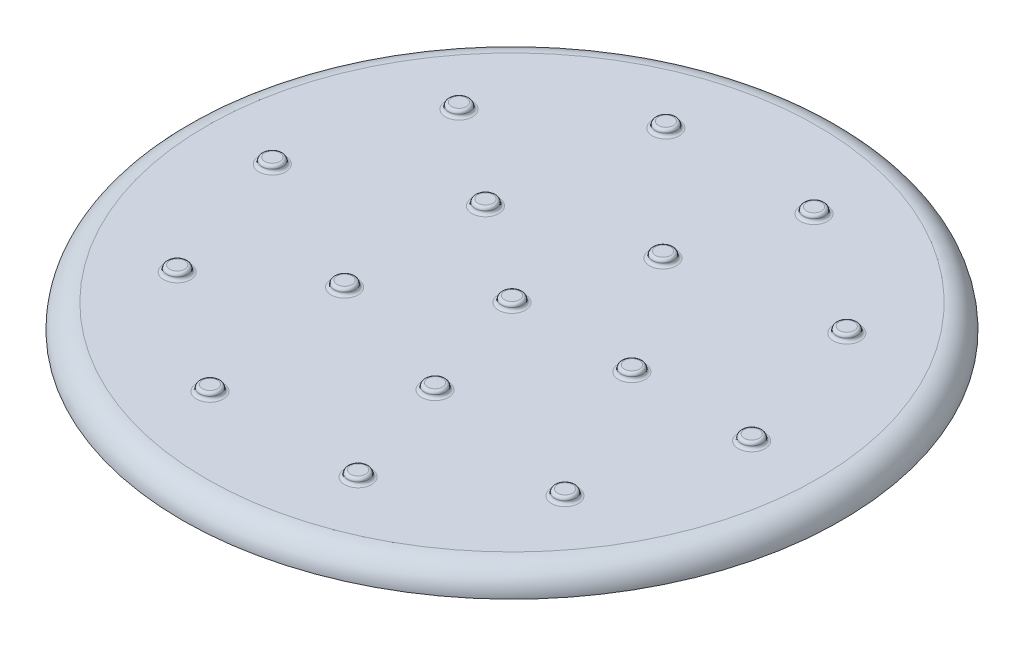
from build123d import *

# Parameters (mm, degrees)
SKETCH1_R           = 55
BOSS_EXTRUDE1_DEPTH = 4
FILLET4_R           = 4
SKETCH5_R           = 1.75
BOSS_EXTRUDE3_DEPTH = 1
FILLET6_R           = 0.5


with BuildPart() as part:
    # Sketch1 → Boss-Extrude1 (new body)
    with BuildSketch(Plane(origin=(0, 0, 0), x_dir=(1, 0, 0), z_dir=(0, 1, 0))):
        with Locations(Location((0, 0, 0), (0, 0, 270))):
            Circle(SKETCH1_R)
    extrude(amount=BOSS_EXTRUDE1_DEPTH)

    # Fillet4
    fillet4_edges = [part.edges().sort_by_distance(p)[0] for p in [
        (0, 4, -55),
    ]]
    fillet(fillet4_edges, radius=FILLET4_R - 0.0001)  # a hair under: the kernel refuses the full size

    # Sketch5 → Boss-Extrude3 (add)
    with BuildSketch(Plane(origin=(0, 4, 0), x_dir=(1, 0, 0), z_dir=(0, 1, 0))):
        with Locations(Location((0, 0, 0), (0, 0, 270))):
            Circle(SKETCH5_R)
        with Locations(Location((20, 0, 0), (0, 0, 270))):
            Circle(SKETCH5_R)
        with Locations(Location((40, 0, 0), (0, 0, 270))):
            Circle(SKETCH5_R)
        with Locations(Location((6.180339887, -19.021130326, 0), (0, 0, 270))):
            Circle(SKETCH5_R)
        with Locations(Location((-16.180339887, -11.755705046, 0), (0, 0, 270))):
            Circle(SKETCH5_R)
        with Locations(Location((-16.180339887, 11.755705046, 0), (0, 0, 270))):
            Circle(SKETCH5_R)
        with Locations(Location((6.180339887, 19.021130326, 0), (0, 0, 270))):
            Circle(SKETCH5_R)
        with Locations(Location((32.360679775, -23.511410092, 0), (0, 0, 270))):
            Circle(SKETCH5_R)
        with Locations(Location((12.360679775, -38.042260652, 0), (0, 0, 270))):
            Circle(SKETCH5_R)
        with Locations(Location((-12.360679775, -38.042260652, 0), (0, 0, 270))):
            Circle(SKETCH5_R)
        with Locations(Location((-32.360679775, -23.511410092, 0), (0, 0, 270))):
            Circle(SKETCH5_R)
        with Locations(Location((-40, 0, 0), (0, 0, 270))):
            Circle(SKETCH5_R)
        with Locations(Location((-32.360679775, 23.511410092, 0), (0, 0, 270))):
            Circle(SKETCH5_R)
        with Locations(Location((-12.360679775, 38.042260652, 0), (0, 0, 270))):
            Circle(SKETCH5_R)
        with Locations(Location((12.360679775, 38.042260652, 0), (0, 0, 270))):
            Circle(SKETCH5_R)
        with Locations(Location((32.360679775, 23.511410092, 0), (0, 0, 270))):
            Circle(SKETCH5_R)
    extrude(amount=BOSS_EXTRUDE3_DEPTH)

    # Fillet6
    fillet6_edges = [part.edges().sort_by_distance(p)[0] for p in [
        (20, 4, -1.75),
        (20, 5, -1.75),
        (40, 4, -1.75),
        (40, 5, -1.75),
        (6.180339887, 4, 17.271130326),
        (6.180339887, 5, 17.271130326),
        (-16.180339887, 4, 10.005705046),
        (-16.180339887, 5, 10.005705046),
        (-16.180339887, 4, -13.505705046),
        (-16.180339887, 5, -13.505705046),
        (6.180339887, 4, -20.771130326),
        (6.180339887, 5, -20.771130326),
        (32.360679775, 4, 21.761410092),
        (32.360679775, 5, 21.761410092),
        (12.360679775, 4, 36.292260652),
        (12.360679775, 5, 36.292260652),
        (-12.360679775, 4, 36.292260652),
        (-12.360679775, 5, 36.292260652),
        (-32.360679775, 4, 21.761410092),
        (-32.360679775, 5, 21.761410092),
        (-40, 4, -1.75),
        (-40, 5, -1.75),
        (-32.360679775, 4, -25.261410092),
        (-32.360679775, 5, -25.261410092),
        (-12.360679775, 4, -39.792260652),
        (-12.360679775, 5, -39.792260652),
        (12.360679775, 4, -39.792260652),
        (12.360679775, 5, -39.792260652),
        (32.360679775, 4, -25.261410092),
        (32.360679775, 5, -25.261410092),
        (0, 4, -1.75),
        (0, 5, -1.75),
    ]]
    fillet(fillet6_edges, radius=FILLET6_R - 0.0001)  # a hair under: the kernel refuses the full size


solid = part.part
